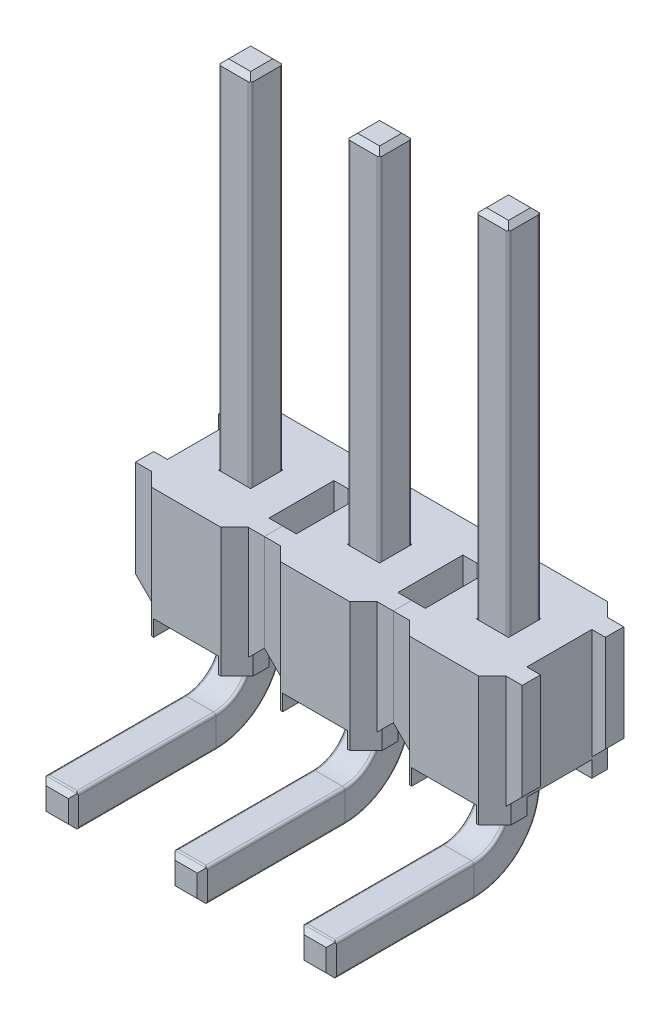
from build123d import *

# Parameters (mm, degrees)
SALIENTE_EXTRUIR1_DEPTH = 2.54
CORTAR_EXTRUIR1_DEPTH   = 4
CROQUIS3_W              = 0.32267472552590215
CROQUIS3_H              = 1.28
CORTAR_EXTRUIR2_DEPTH   = 3
CORTAR_EXTRUIR4_DEPTH   = 0.3175
CROQUIS5_W              = 0.32267472552590304
CROQUIS5_H              = 2.226975645492306
CROQUIS5_W_2            = 0.34904033467259876
CROQUIS5_H_2            = 2.1795570227935146
CORTAR_EXTRUIR5_DEPTH   = 0.3175
CHAFL_N1_SIZE           = 0.3175
CHAFL_N2_SIZE           = 0.3175
CROQUIS6_W              = 2.1883455591757466
CROQUIS6_H              = 1.28
CORTAR_EXTRUIR6_DEPTH   = 0.3175
CHAFL_N6_SIZE           = 0.1
REDONDEO5_R             = 0.05
REDONDEO6_R             = 0.05
MATRIZL1_COUNT          = 3
MATRIZL1_PITCH          = 2.54


with BuildPart() as part:
    # Croquis1 → Saliente-Extruir1 (new body)
    with BuildSketch(Plane(origin=(0, 0, 0), x_dir=(1, 0, 0), z_dir=(0, 1, 0))):
        Polygon((-1.27, 1), (-1, 1), (-1, 1.27), (1, 1.27), (1, 1), (1.27, 1), (1.27, -1), (1, -1), (1, -1.2699999999999998), (-1, -1.2699999999999998), (-1, -1), (-1.27, -1), align=None)
    extrude(amount=SALIENTE_EXTRUIR1_DEPTH)

    # Croquis2 → Cortar-Extruir1 (cut)
    with BuildSketch(Plane(origin=(0, 0, 0), x_dir=(1, 0, 0), z_dir=(0, 1, 0))):
        Polygon((-0.3175, 0.3175), (0.3174999999999999, 0.3175), (0.3175, -0.31749999999999995), (-0.31749999999999995, -0.31749999999999995), align=None)
    extrude(amount=CORTAR_EXTRUIR1_DEPTH, mode=Mode.SUBTRACT)

    # Croquis3 → Cortar-Extruir2 (cut)
    with BuildSketch(Plane(origin=(0, 0, 0), x_dir=(1, 0, 0), z_dir=(0, 1, 0))):
        with Locations((-1.161337362762951, 0)):
            Rectangle(CROQUIS3_W, CROQUIS3_H)
        Polygon((1, 0.64), (1.3182804573347866, 0.64), (1.3182804573347866, -0.64), (1.0000000000000002, -0.64), align=None)
    extrude(amount=CORTAR_EXTRUIR2_DEPTH, mode=Mode.SUBTRACT)

    # Croquis4 → Cortar-Extruir4 (cut)
    with BuildSketch(Plane(origin=(0, 0, 0), x_dir=(1, 0, 0), z_dir=(0, 1, 0))):
        Polygon((-0.64, 1.3130073355054386), (0.6399999999999998, 1.3130073355054386), (0.64, -1.3256628278958706), (-0.6399999999999997, -1.3256628278958706), align=None)
    extrude(amount=CORTAR_EXTRUIR4_DEPTH, mode=Mode.SUBTRACT)

    # Croquis5 → Cortar-Extruir5 (cut)
    with BuildSketch(Plane(origin=(0, 0, 0), x_dir=(1, 0, 0), z_dir=(0, 1, 0))):
        with Locations((-1.1613373627629515, -0.0215121772538468)):
            Rectangle(CROQUIS5_W, CROQUIS5_H)
        with Locations((1.1745201673362993, 0.00219713409554911)):
            Rectangle(CROQUIS5_W_2, CROQUIS5_H_2)
    extrude(amount=CORTAR_EXTRUIR5_DEPTH, mode=Mode.SUBTRACT)

    # Chaflán1
    # the kernel refuses this chamfer: 0.3175 mm, written as the material it takes off along each edge
    with BuildSketch(Plane(origin=(1.27, 0.3175, 0.17650934867917645), x_dir=(0.027495876610586608, 0.9996219169112968, 0), z_dir=(0, 0, -1))) as chafl_n1_piece_1_section:
        Polygon((CHAFL_N1_SIZE * 0.999621916911, -CHAFL_N1_SIZE * 0.0274958766106), (-CHAFL_N1_SIZE * 0.0274958766106, -CHAFL_N1_SIZE * 0.999621916911), (0, 0), align=None)
    chafl_n1_piece_1 = extrude(amount=1.9930186973583528, mode=Mode.PRIVATE)
    chafl_n1_piece_1 = split(chafl_n1_piece_1, bisect_by=Plane(origin=(1, 0.42554304187186154, -0.8199999999999998), z_dir=(1, 0, 0)), keep=Keep.TOP, mode=Mode.PRIVATE)
    add(chafl_n1_piece_1, mode=Mode.SUBTRACT)
    with BuildSketch(Plane(origin=(1.27, 0.3175, 1.8165093486791761), x_dir=(0.027495876610586608, 0.9996219169112968, 0), z_dir=(0, 0, -1))) as chafl_n1_piece_2_section:
        Polygon((CHAFL_N1_SIZE * 0.999621916911, -CHAFL_N1_SIZE * 0.0274958766106), (-CHAFL_N1_SIZE * 0.0274958766106, -CHAFL_N1_SIZE * 0.999621916911), (0, 0), align=None)
    chafl_n1_piece_2 = extrude(amount=1.9930186973583528, mode=Mode.PRIVATE)
    chafl_n1_piece_2 = split(chafl_n1_piece_2, bisect_by=Plane(origin=(1, 0.42554304187186154, 0.8199999999999998), z_dir=(1, 0, 0)), keep=Keep.TOP, mode=Mode.PRIVATE)
    add(chafl_n1_piece_2, mode=Mode.SUBTRACT)
    with BuildSketch(Plane(origin=(-1.27, 0.3175, -0.17650934867917645), x_dir=(-0.027495876610586608, 0.9996219169112968, 0), z_dir=(0, 0, 1))) as chafl_n1_piece_3_section:
        Polygon((CHAFL_N1_SIZE * 0.999621916911, -CHAFL_N1_SIZE * 0.0274958766106), (-CHAFL_N1_SIZE * 0.0274958766106, -CHAFL_N1_SIZE * 0.999621916911), (0, 0), align=None)
    chafl_n1_piece_3 = extrude(amount=1.993018697358353, mode=Mode.PRIVATE)
    chafl_n1_piece_3 = split(chafl_n1_piece_3, bisect_by=Plane(origin=(-1, 0.42554304187186154, 0.8200000000000003), z_dir=(-1, 0, 0)), keep=Keep.TOP, mode=Mode.PRIVATE)
    add(chafl_n1_piece_3, mode=Mode.SUBTRACT)
    with BuildSketch(Plane(origin=(-1.27, 0.3175, -1.8165093486791766), x_dir=(-0.027495876610586608, 0.9996219169112968, 0), z_dir=(0, 0, 1))) as chafl_n1_piece_4_section:
        Polygon((CHAFL_N1_SIZE * 0.999621916911, -CHAFL_N1_SIZE * 0.0274958766106), (-CHAFL_N1_SIZE * 0.0274958766106, -CHAFL_N1_SIZE * 0.999621916911), (0, 0), align=None)
    chafl_n1_piece_4 = extrude(amount=1.993018697358353, mode=Mode.PRIVATE)
    chafl_n1_piece_4 = split(chafl_n1_piece_4, bisect_by=Plane(origin=(-1, 0.42554304187186154, -0.8200000000000002), z_dir=(-1, 0, 0)), keep=Keep.TOP, mode=Mode.PRIVATE)
    add(chafl_n1_piece_4, mode=Mode.SUBTRACT)

    # Chaflán2
    chafl_n2_edges = [part.edges().sort_by_distance(p)[0] for p in [
        (-1, 1.27, -1.27),
        (1, 1.27, -1.27),
        (-1, 1.27, 1.2699999999999998),
        (1, 1.27, 1.2699999999999998),
    ]]
    chamfer(chafl_n2_edges, length=CHAFL_N2_SIZE)

    # Croquis6 → Cortar-Extruir6 (cut)
    with BuildSketch(Plane(origin=(0, 0, 0), x_dir=(1, 0, 0), z_dir=(0, 1, 0))):
        with Locations((0.01757707276446407, 0)):
            Rectangle(CROQUIS6_W, CROQUIS6_H)
    extrude(amount=CORTAR_EXTRUIR6_DEPTH, mode=Mode.SUBTRACT)


with BuildPart() as body_2:
    # Barrer1: sweep along a path in Croquis9
    with BuildLine(Plane(origin=(0, 0, 0), x_dir=(0, 0, -1), z_dir=(1, 0, 0))) as barrer1_path:
        Line((0, 9.55647732058651), (0, -0.2699999999999929))
        ThreePointArc((0, -0.2699999999999929), (-0.2928932188134524, -0.9771067811865475), (-1.000000000000007, -1.27))
        Line((-1.000000000000007, -1.27), (-3.81, -1.27))
    # Croquis10 → Barrer1 (sweep)
    with BuildSketch(Plane.XY.offset(3.81)):
        Polygon((-0.3175, -0.9525), (0.3174999999999999, -0.9525), (0.31749999999999995, -1.5875), (-0.31749999999999995, -1.5875), align=None)
    sweep(path=barrer1_path.line)

    # Chaflán6
    chafl_n6_edges = [body_2.edges().sort_by_distance(p)[0] for p in [
        (0, 9.556477320586515, -0.3174999999999999),
        (0.3174999999999999, 9.55647732058651, -6e-17),
        (-6e-17, 9.556477320586506, 0.3174999999999999),
        (-0.3175, -1.27, 3.8099999999999987),
        (0, -1.5875, 3.8099999999999987),
        (0.3174999999999999, -1.27, 3.8099999999999987),
        (-6e-17, -0.9525000000000001, 3.8099999999999987),
        (-0.3175, 9.556477320586511, 6e-17),
    ]]
    chamfer(chafl_n6_edges, length=CHAFL_N6_SIZE)

    # Redondeo5
    # the kernel refuses this fillet: 0.05 mm, written as the material it takes off along each edge
    with BuildSketch(Plane(origin=(0.3692766953019151, -0.9525000000000001, 3.709999999999999), x_dir=(0, 0, -1), z_dir=(-1, 0, 0))) as redondeo5_piece_1:
        with BuildLine():
            CenterArc((REDONDEO5_R * 0.414213562373, REDONDEO5_R), REDONDEO5_R, 225.00000000000009, 44.999999999999886)
            Line((-REDONDEO5_R * 0.292893218813, REDONDEO5_R * 0.292893218813), (0, 0))
            Line((0, 0), (REDONDEO5_R * 0.414213562373, 0))
        make_face()
    extrude(amount=0.7385533905932721, mode=Mode.SUBTRACT)
    with BuildSketch(Plane(origin=(-0.3175, -0.2699999999999997, 1.0000000000000004), x_dir=(0, 5.37e-15, -1), z_dir=(0, 1, 5.37e-15))) as redondeo5_piece_2:
        with BuildLine():
            CenterArc((0.6825000000000006 + REDONDEO5_R, -REDONDEO5_R), REDONDEO5_R, 90.00000000000013, 89.99999999999989)
            Line((0.6825000000000006 + REDONDEO5_R, -6e-17), (0.6825000000000006, 0))
            Line((0.6825000000000006, 0), (0.6825000000000006, -REDONDEO5_R))
        make_face()
    revolve(axis=Axis((-0.3175, -0.2699999999999997, 1.0000000000000004), (-1, 0, 0)), revolution_arc=90.00000000000078, mode=Mode.SUBTRACT)
    with BuildSketch(Plane(origin=(0.3174999999999999, 9.58147732058651, 0.3174999999999999), x_dir=(-1, 0, 0), z_dir=(0, -1, 0))) as redondeo5_piece_3:
        with BuildLine():
            CenterArc((REDONDEO5_R, REDONDEO5_R), REDONDEO5_R, 180, 90)
            Line((-6e-17, REDONDEO5_R), (0, 0))
            Line((0, 0), (REDONDEO5_R, 0))
        make_face()
    extrude(amount=9.851477320586506, mode=Mode.SUBTRACT)
    with BuildSketch(Plane(origin=(-0.3175, 9.581477320586506, 0.3174999999999999), x_dir=(1, 0, 0), z_dir=(0, -1, 0))) as redondeo5_piece_4:
        with BuildLine():
            CenterArc((REDONDEO5_R, -REDONDEO5_R), REDONDEO5_R, 90, 90.00000000000006)
            Line((6e-17, -REDONDEO5_R), (0, 0))
            Line((0, 0), (REDONDEO5_R, 0))
        make_face()
    extrude(amount=9.851477320586502, mode=Mode.SUBTRACT)
    with BuildSketch(Plane(origin=(0.3174999999999999, -0.2699999999999997, 1.0000000000000004), x_dir=(0, 5.37e-15, -1), z_dir=(0, 1, 5.37e-15))) as redondeo5_piece_5:
        with BuildLine():
            CenterArc((0.6825000000000006 + REDONDEO5_R, REDONDEO5_R), REDONDEO5_R, 180.00000000000006, 89.99999999999994)
            Line((0.6825000000000006, REDONDEO5_R), (0.6825000000000006, 0))
            Line((0.6825000000000006, 0), (0.6825000000000006 + REDONDEO5_R, 0))
        make_face()
    revolve(axis=Axis((0.3174999999999999, -0.2699999999999997, 1.0000000000000004), (-1, 0, 0)), revolution_arc=90.00000000000078, mode=Mode.SUBTRACT)
    with BuildSketch(Plane(origin=(-0.3175, -0.9525000000000001, 1.000000000000006), x_dir=(-1.11e-15, -1, 0), z_dir=(0, 0, 1))) as redondeo5_piece_6:
        with BuildLine():
            CenterArc((REDONDEO5_R, REDONDEO5_R), REDONDEO5_R, 180, 90.00000000000006)
            Line((1.05e-15, REDONDEO5_R), (0, 0))
            Line((0, 0), (REDONDEO5_R, 0))
        make_face()
    extrude(amount=2.834999999999993, mode=Mode.SUBTRACT)
    with BuildSketch(Plane(origin=(0.3174999999999999, -0.9525000000000001, 1.000000000000006), x_dir=(-1.11e-15, -1, 0), z_dir=(0, 0, 1))) as redondeo5_piece_7:
        with BuildLine():
            CenterArc((REDONDEO5_R, -REDONDEO5_R), REDONDEO5_R, 90.00000000000006, 89.99999999999989)
            Line((-6.1e-16, -REDONDEO5_R), (0, 0))
            Line((0, 0), (REDONDEO5_R, 0))
        make_face()
    extrude(amount=2.834999999999992, mode=Mode.SUBTRACT)

    # Redondeo6
    # the kernel refuses this fillet: 0.05 mm, written as the material it takes off along each edge
    with BuildSketch(Plane(origin=(-0.36927669530191515, -1.5875, 3.709999999999999), x_dir=(0, 0, -1), z_dir=(1, 0, 0))) as redondeo6_piece_1:
        with BuildLine():
            CenterArc((REDONDEO6_R * 0.414213562373, REDONDEO6_R), REDONDEO6_R, 225, 45)
            Line((-REDONDEO6_R * 0.292893218813, REDONDEO6_R * 0.292893218813), (0, 0))
            Line((0, 0), (REDONDEO6_R * 0.414213562373, 0))
        make_face()
    extrude(amount=0.7385533905932721, mode=Mode.SUBTRACT)
    with BuildSketch(Plane(origin=(0.31749999999999995, 9.581477320586517, -0.3174999999999999), x_dir=(0, 0, 1), z_dir=(0, -1, 0))) as redondeo6_piece_2:
        with BuildLine():
            CenterArc((REDONDEO6_R, REDONDEO6_R), REDONDEO6_R, 180, 90)
            Line((6e-17, REDONDEO6_R), (0, 0))
            Line((0, 0), (REDONDEO6_R, 0))
        make_face()
    extrude(amount=9.851477320586504, mode=Mode.SUBTRACT)
    with BuildSketch(Plane(origin=(-0.31749999999999995, 9.581477320586517, -0.3174999999999999), x_dir=(0, -1.348e-14, 1), z_dir=(0, -1, -1.348e-14))) as redondeo6_piece_3:
        with BuildLine():
            CenterArc((REDONDEO6_R, -REDONDEO6_R), REDONDEO6_R, 90, 89.99999999999994)
            Line((0, -REDONDEO6_R), (0, 0))
            Line((0, 0), (REDONDEO6_R, 0))
        make_face()
    extrude(amount=9.851477320586504, mode=Mode.SUBTRACT)
    with BuildSketch(Plane(origin=(-0.31749999999999995, -0.2699999999999997, 1.0000000000000004), x_dir=(0, 9.19e-15, -1), z_dir=(0, 1, 9.19e-15))) as redondeo6_piece_4:
        with BuildLine():
            CenterArc((1.3175000000000003 - REDONDEO6_R, -REDONDEO6_R), REDONDEO6_R, 6.361e-14, 89.99999999999994)
            Line((1.3175000000000003, -REDONDEO6_R), (1.3175000000000003, 0))
            Line((1.3175000000000003, 0), (1.3175000000000003 - REDONDEO6_R, 0))
        make_face()
    revolve(axis=Axis((-0.31749999999999995, -0.2699999999999997, 1.0000000000000004), (-1, 0, 0)), revolution_arc=90.00000000000078, mode=Mode.SUBTRACT)
    with BuildSketch(Plane(origin=(0.31749999999999995, -0.2699999999999997, 1.0000000000000004), x_dir=(0, 9.19e-15, -1), z_dir=(0, 1, 9.19e-15))) as redondeo6_piece_5:
        with BuildLine():
            CenterArc((1.3175000000000003 - REDONDEO6_R, REDONDEO6_R), REDONDEO6_R, 270, 90)
            Line((1.3175000000000001, REDONDEO6_R), (1.3175000000000003, 0))
            Line((1.3175000000000003, 0), (1.3175000000000003 - REDONDEO6_R, 0))
        make_face()
    revolve(axis=Axis((0.31749999999999995, -0.2699999999999997, 1.0000000000000004), (-1, 0, 0)), revolution_arc=90.00000000000078, mode=Mode.SUBTRACT)
    with BuildSketch(Plane(origin=(-0.31749999999999995, -1.5875, 1.000000000000006), x_dir=(-2.22e-15, 1, 0), z_dir=(0, 0, 1))) as redondeo6_piece_6:
        with BuildLine():
            CenterArc((REDONDEO6_R, -REDONDEO6_R), REDONDEO6_R, 89.99999999999987, 90.00000000000007)
            Line((1.1e-16, -REDONDEO6_R), (0, 0))
            Line((0, 0), (REDONDEO6_R, 0))
        make_face()
    extrude(amount=2.834999999999993, mode=Mode.SUBTRACT)
    with BuildSketch(Plane(origin=(0.31749999999999995, -1.5875, 1.000000000000006), x_dir=(-2.22e-15, 1, 0), z_dir=(0, 0, 1))) as redondeo6_piece_7:
        with BuildLine():
            CenterArc((REDONDEO6_R, REDONDEO6_R), REDONDEO6_R, 180, 89.99999999999989)
            Line((3.3e-16, REDONDEO6_R), (0, 0))
            Line((0, 0), (REDONDEO6_R, 0))
        make_face()
    extrude(amount=2.8349999999999973, mode=Mode.SUBTRACT)


with BuildPart() as matrizl1_1:
    # MatrizL1: pattern copy
    add(part.part.moved(Location(Vector(1, 1e-17, 0) * (1 * MATRIZL1_PITCH))))


with BuildPart() as matrizl1_2:
    # MatrizL1: pattern copy
    add(part.part.moved(Location(Vector(1, 1e-17, 0) * (2 * MATRIZL1_PITCH))))


with BuildPart() as matrizl1_3:
    # MatrizL1: pattern copy
    add(body_2.part.moved(Location(Vector(1, 1e-17, 0) * (1 * MATRIZL1_PITCH))))


with BuildPart() as matrizl1_4:
    # MatrizL1: pattern copy
    add(body_2.part.moved(Location(Vector(1, 1e-17, 0) * (2 * MATRIZL1_PITCH))))


solid = Compound([part.part, body_2.part, matrizl1_1.part, matrizl1_2.part, matrizl1_3.part, matrizl1_4.part])
